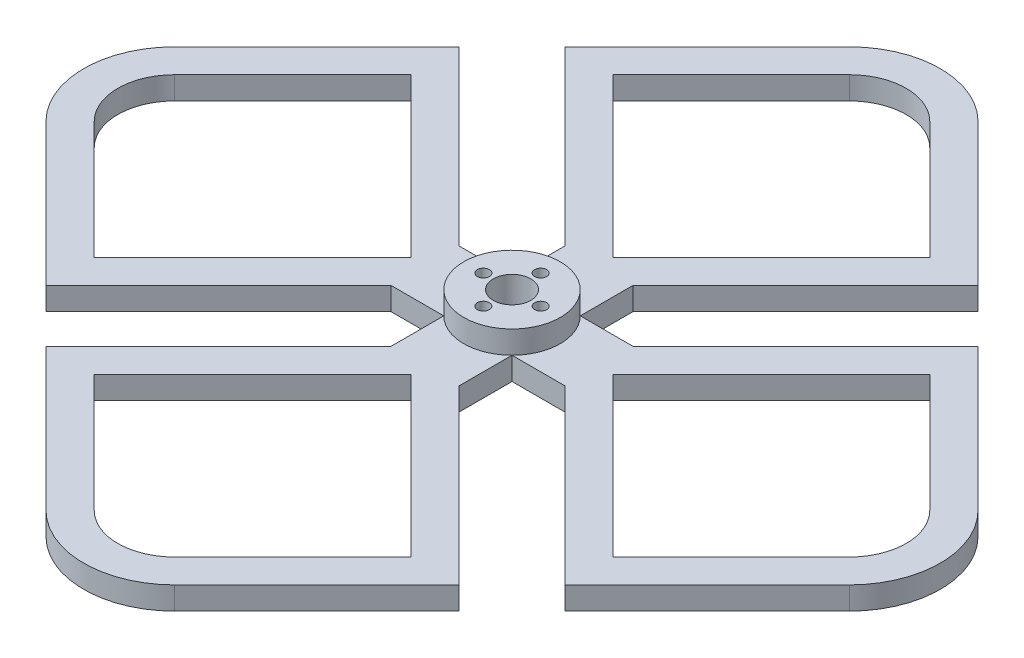
from build123d import *

# Parameters (mm, degrees)
BOSS_EXTRUDE5_DEPTH      = 6.35
FILLET1_R                = 25.4
CUT_EXTRUDE3_DEPTH       = 133.905327416
CIRPATTERN7_COUNT        = 4
FILLET1_OF_CIRPATTERN7_R = 25.4
SKETCH13_R               = 13.470384182
BOSS_EXTRUDE8_DEPTH      = 6.35
SKETCH1_R                = 5.22699996
SKETCH1_R_2              = 1.686500056
CUT_EXTRUDE1_DEPTH       = 170.589221223


with BuildPart() as part:
    # Sketch4 → Boss-Extrude5 (new body)
    with BuildSketch(Plane(origin=(0, 0, 0), x_dir=(1, 0, 0), z_dir=(0, 1, 0))):
        Polygon((24.3205, 9.525), (0, 9.525), (0, -9.525), (24.3205, -9.525), (72.448744297, -57.653244297), (130.101988595, 0), (72.448744297, 57.653244297), align=None)
    boss_extrude5 = extrude(amount=BOSS_EXTRUDE5_DEPTH)

    # Fillet1
    fillet1_edges = [part.edges().sort_by_distance(p)[0] for p in [
        (130.101988595, 3.175, 0),
    ]]
    fillet(fillet1_edges, radius=FILLET1_R)

    # Sketch12 → Cut-Extrude3 (cut, through all)
    with BuildSketch(Plane(origin=(0, 6.35, 0), x_dir=(1, 0, 0), z_dir=(0, 1, 0))):
        with BuildLine():
            Line((72.448744297, -44.182860116), (105.406284262, -11.225320151))
            ThreePointArc((105.406284262, -11.225320151), (110.05596411, 0), (105.406284262, 11.225320151))
            Line((105.406284262, 11.225320151), (72.448744297, 44.182860116))
            Line((72.448744297, 44.182860116), (28.265884182, 0))
            Line((28.265884182, 0), (72.448744297, -44.182860116))
        make_face()
    cut_extrude3 = extrude(amount=-CUT_EXTRUDE3_DEPTH, mode=Mode.SUBTRACT)

    # CirPattern7: Boss-Extrude5, Cut-Extrude3 ×4 about axis
    cirpattern7_axis = Axis((0, 0, 0), (0, 1, 0))
    add([boss_extrude5.rotate(cirpattern7_axis, i * 360 / CIRPATTERN7_COUNT) for i in range(1, CIRPATTERN7_COUNT)])
    add([cut_extrude3.rotate(cirpattern7_axis, i * 360 / CIRPATTERN7_COUNT) for i in range(1, CIRPATTERN7_COUNT)], mode=Mode.SUBTRACT)

    # Fillet1 of CirPattern7
    fillet1_of_cirpattern7_edges = [part.edges().sort_by_distance(p)[0] for p in [
        (0, 3.175, -130.101988595),
        (-130.101988595, 3.175, 0),
        (0, 3.175, 130.101988595),
    ]]
    fillet(fillet1_of_cirpattern7_edges, radius=FILLET1_OF_CIRPATTERN7_R)

    # Sketch13 → Boss-Extrude8 (add)
    with BuildSketch(Plane(origin=(0, 6.35, 0), x_dir=(1, 0, 0), z_dir=(0, 1, 0))):
        Circle(SKETCH13_R)
    extrude(amount=BOSS_EXTRUDE8_DEPTH)

    # Sketch1 → Cut-Extrude1 (cut, through all)
    with BuildSketch(Plane(origin=(0, 0, 0), x_dir=(1, 0, 0), z_dir=(0, 1, 0))):
        Circle(SKETCH1_R)
        with Locations((8.000000002, 0)):
            Circle(SKETCH1_R_2)
        with Locations((0, -8.000000002)):
            Circle(SKETCH1_R_2)
        with Locations((-8.000000002, 0)):
            Circle(SKETCH1_R_2)
        with Locations((0, 8.000000002)):
            Circle(SKETCH1_R_2)
    extrude(amount=CUT_EXTRUDE1_DEPTH, mode=Mode.SUBTRACT)


solid = part.part
